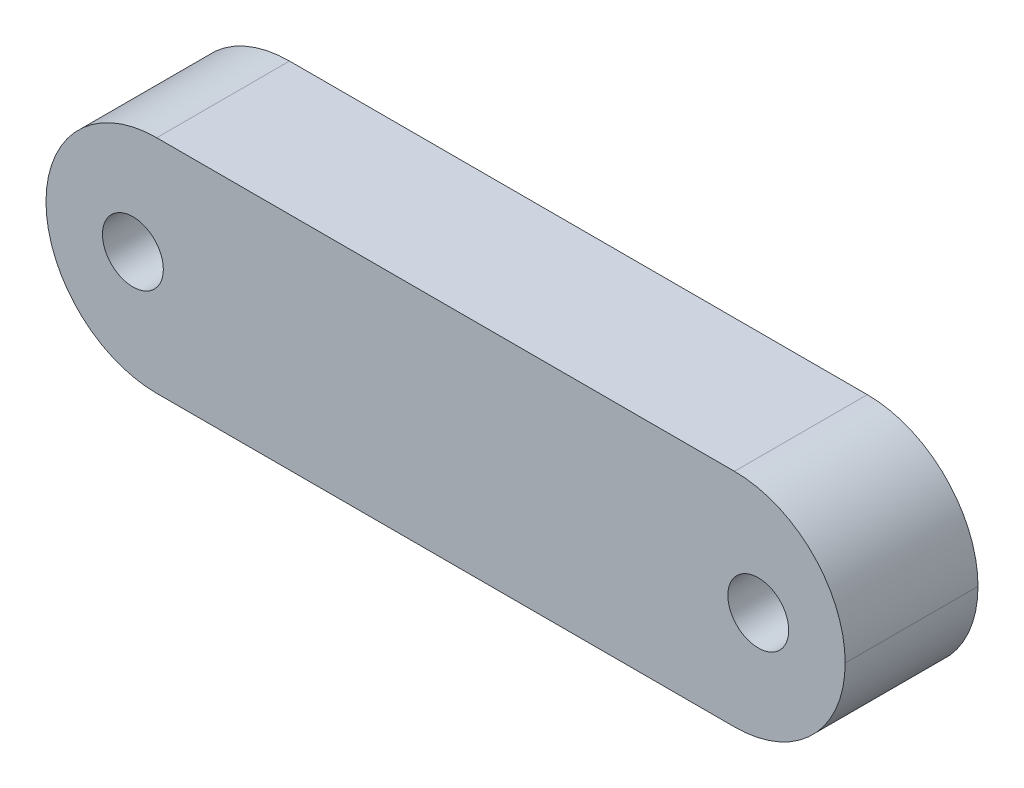
from build123d import *

# Parameters (mm, degrees)
SKETCH1_W           = 72.2
SKETCH1_H           = 20
SKETCH1_R           = 2.75
BOSS_EXTRUDE1_DEPTH = 12
FILLET1_R           = 10


with BuildPart() as part:
    # Sketch1 → Boss-Extrude1 (new body)
    with BuildSketch(Plane.XY):
        Rectangle(SKETCH1_W, SKETCH1_H)
        with Locations((-28.25, 0)):
            Circle(SKETCH1_R, mode=Mode.SUBTRACT)
        with Locations((28.25, 0)):
            Circle(SKETCH1_R, mode=Mode.SUBTRACT)
    extrude(amount=BOSS_EXTRUDE1_DEPTH)

    # Fillet1
    fillet1_edges = [part.edges().sort_by_distance(p)[0] for p in [
        (36.1, 10, 6),
        (36.1, -10, 6),
        (-36.1, 10, 6),
        (-36.1, -10, 6),
    ]]
    fillet(fillet1_edges, radius=FILLET1_R - 0.0001)  # a hair under: the kernel refuses the full size


solid = part.part
